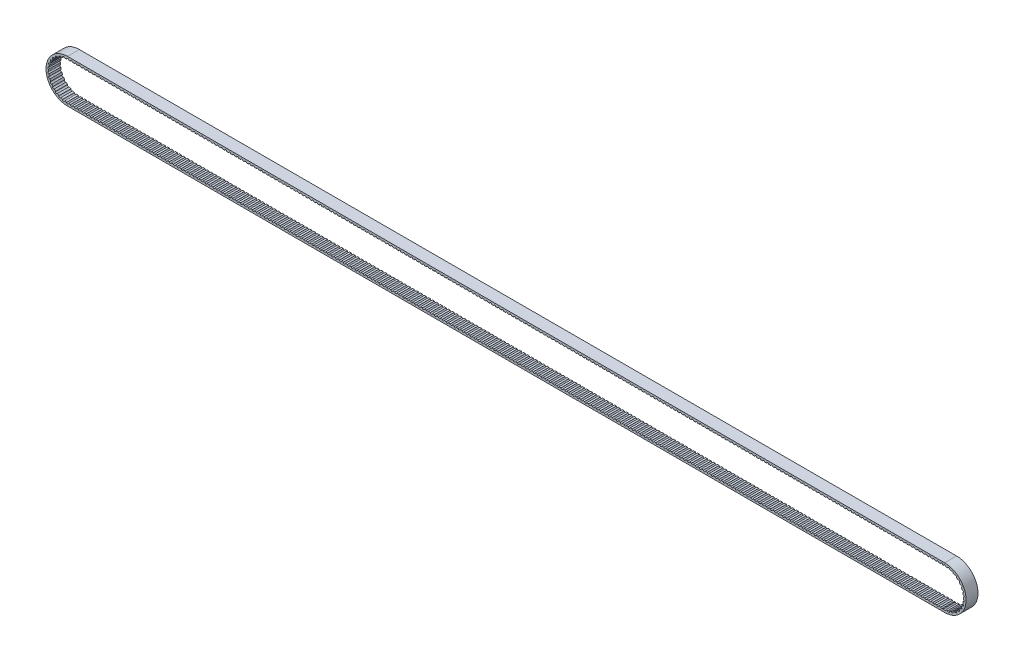
from build123d import *

# Parameters (mm, degrees)
EXTRUDE_THIN1_DEPTH      = 3
SKETCH2_R                = 0.5
CUT_EXTRUDE1_DEPTH       = 233.961566143
LPATTERN1_COUNT          = 222
LPATTERN1_PITCH          = 2
CIRPATTERN1_COUNT        = 16
CIRPATTERN1_ANGLE        = 180
MIRROR1_START            = -4
MIRROR1_DEPTH            = 8
MIRROR2_COPY_1_SKETCH_R  = 0.5
MIRROR2_COPY_1_DEPTH     = 233.961566143
MIRROR2_COPY_2_SKETCH_R  = 0.5
MIRROR2_COPY_2_DEPTH     = 233.961566143
MIRROR2_COPY_3_SKETCH_R  = 0.5
MIRROR2_COPY_3_DEPTH     = 233.961566143
MIRROR2_COPY_4_SKETCH_R  = 0.5
MIRROR2_COPY_4_DEPTH     = 233.961566143
MIRROR2_COPY_5_SKETCH_R  = 0.5
MIRROR2_COPY_5_DEPTH     = 233.961566143
MIRROR2_COPY_6_SKETCH_R  = 0.5
MIRROR2_COPY_6_DEPTH     = 233.961566143
MIRROR2_COPY_7_SKETCH_R  = 0.5
MIRROR2_COPY_7_DEPTH     = 233.961566143
MIRROR2_COPY_8_SKETCH_R  = 0.5
MIRROR2_COPY_8_DEPTH     = 233.961566143
MIRROR2_COPY_9_SKETCH_R  = 0.5
MIRROR2_COPY_9_DEPTH     = 233.961566143
MIRROR2_COPY_10_SKETCH_R = 0.5
MIRROR2_COPY_10_DEPTH    = 233.961566143
MIRROR2_COPY_11_SKETCH_R = 0.5
MIRROR2_COPY_11_DEPTH    = 233.961566143
MIRROR2_COPY_12_SKETCH_R = 0.5
MIRROR2_COPY_12_DEPTH    = 233.961566143
MIRROR2_COPY_13_SKETCH_R = 0.5
MIRROR2_COPY_13_DEPTH    = 233.961566143
MIRROR2_COPY_14_SKETCH_R = 0.5
MIRROR2_COPY_14_DEPTH    = 233.961566143
MIRROR2_COPY_15_SKETCH_R = 0.5
MIRROR2_COPY_15_DEPTH    = 233.961566143


with BuildPart() as part:
    # Sketch1 → Extrude-Thin1 (new, symmetric)
    with BuildSketch(Plane.XY):
        with BuildLine():
            Line((221.75, -10.88), (-221.75, -10.88))
            ThreePointArc((-221.75, -10.88), (-232.63, 0), (-221.75, 10.88))
            Line((-221.75, 10.88), (221.75, 10.88))
            ThreePointArc((221.75, 10.88), (232.63, 0), (221.75, -10.88))
        make_face()
        with BuildLine():
            Line((221.75, -9.5), (-221.75, -9.5))
            ThreePointArc((-221.75, -9.5), (-231.25, 0), (-221.75, 9.5))
            Line((-221.75, 9.5), (221.75, 9.5))
            ThreePointArc((221.75, 9.5), (231.25, 0), (221.75, -9.5))
        make_face(mode=Mode.SUBTRACT)
    extrude(amount=EXTRUDE_THIN1_DEPTH, both=True)

    # Sketch2 → Cut-Extrude1 (cut, through all)
    with BuildSketch(Plane.XY.offset(3)):
        with Locations((-221.75, 9.5)):
            Circle(SKETCH2_R)
    cut_extrude1 = extrude(amount=-CUT_EXTRUDE1_DEPTH, mode=Mode.SUBTRACT)

    # LPattern1: Cut-Extrude1 ×222
    with Locations(*[(i * LPATTERN1_PITCH, 0, 0) for i in range(1, LPATTERN1_COUNT)]):
        add(cut_extrude1, mode=Mode.SUBTRACT)

    # CirPattern1: Cut-Extrude1 ×16 about axis
    cirpattern1_axis = Axis((-221.75, 0, 0), (0, 0, 1))
    for i in range(1, CIRPATTERN1_COUNT):
        add(cut_extrude1.rotate(cirpattern1_axis, i * CIRPATTERN1_ANGLE / (CIRPATTERN1_COUNT - 1)), mode=Mode.SUBTRACT)

    # Mirror1: read off the stored shape, not the designer's step
    # Mirror1 outline → Mirror1 (cut)
    with BuildSketch(Plane.XY.offset(MIRROR1_START)):
        with BuildLine():
            Line((-219.25, -9.5), (-220.25, -9.5))
            ThreePointArc((-220.25, -9.5), (-219.75, -10), (-219.25, -9.5))
        make_face()
        with BuildLine():
            Line((220.75, -9.5), (219.75, -9.5))
            ThreePointArc((219.75, -9.5), (220.25, -10), (220.75, -9.5))
        make_face()
        with BuildLine():
            Line((218.75, -9.5), (217.75, -9.5))
            ThreePointArc((217.75, -9.5), (218.25, -10), (218.75, -9.5))
        make_face()
        with BuildLine():
            Line((216.75, -9.5), (215.75, -9.5))
            ThreePointArc((215.75, -9.5), (216.25, -10), (216.75, -9.5))
        make_face()
        with BuildLine():
            Line((214.75, -9.5), (213.75, -9.5))
            ThreePointArc((213.75, -9.5), (214.25, -10), (214.75, -9.5))
        make_face()
        with BuildLine():
            Line((212.75, -9.5), (211.75, -9.5))
            ThreePointArc((211.75, -9.5), (212.25, -10), (212.75, -9.5))
        make_face()
        with BuildLine():
            Line((210.75, -9.5), (209.75, -9.5))
            ThreePointArc((209.75, -9.5), (210.25, -10), (210.75, -9.5))
        make_face()
        with BuildLine():
            Line((208.75, -9.5), (207.75, -9.5))
            ThreePointArc((207.75, -9.5), (208.25, -10), (208.75, -9.5))
        make_face()
        with BuildLine():
            Line((206.75, -9.5), (205.75, -9.5))
            ThreePointArc((205.75, -9.5), (206.25, -10), (206.75, -9.5))
        make_face()
        with BuildLine():
            Line((204.75, -9.5), (203.75, -9.5))
            ThreePointArc((203.75, -9.5), (204.25, -10), (204.75, -9.5))
        make_face()
        with BuildLine():
            Line((202.75, -9.5), (201.75, -9.5))
            ThreePointArc((201.75, -9.5), (202.25, -10), (202.75, -9.5))
        make_face()
        with BuildLine():
            Line((200.75, -9.5), (199.75, -9.5))
            ThreePointArc((199.75, -9.5), (200.25, -10), (200.75, -9.5))
        make_face()
        with BuildLine():
            Line((198.75, -9.5), (197.75, -9.5))
            ThreePointArc((197.75, -9.5), (198.25, -10), (198.75, -9.5))
        make_face()
        with BuildLine():
            Line((196.75, -9.5), (195.75, -9.5))
            ThreePointArc((195.75, -9.5), (196.25, -10), (196.75, -9.5))
        make_face()
        with BuildLine():
            Line((194.75, -9.5), (193.75, -9.5))
            ThreePointArc((193.75, -9.5), (194.25, -10), (194.75, -9.5))
        make_face()
        with BuildLine():
            Line((192.75, -9.5), (191.75, -9.5))
            ThreePointArc((191.75, -9.5), (192.25, -10), (192.75, -9.5))
        make_face()
        with BuildLine():
            Line((190.75, -9.5), (189.75, -9.5))
            ThreePointArc((189.75, -9.5), (190.25, -10), (190.75, -9.5))
        make_face()
        with BuildLine():
            Line((188.75, -9.5), (187.75, -9.5))
            ThreePointArc((187.75, -9.5), (188.25, -10), (188.75, -9.5))
        make_face()
        with BuildLine():
            Line((186.75, -9.5), (185.75, -9.5))
            ThreePointArc((185.75, -9.5), (186.25, -10), (186.75, -9.5))
        make_face()
        with BuildLine():
            Line((184.75, -9.5), (183.75, -9.5))
            ThreePointArc((183.75, -9.5), (184.25, -10), (184.75, -9.5))
        make_face()
        with BuildLine():
            Line((182.75, -9.5), (181.75, -9.5))
            ThreePointArc((181.75, -9.5), (182.25, -10), (182.75, -9.5))
        make_face()
        with BuildLine():
            Line((180.75, -9.5), (179.75, -9.5))
            ThreePointArc((179.75, -9.5), (180.25, -10), (180.75, -9.5))
        make_face()
        with BuildLine():
            Line((178.75, -9.5), (177.75, -9.5))
            ThreePointArc((177.75, -9.5), (178.25, -10), (178.75, -9.5))
        make_face()
        with BuildLine():
            Line((176.75, -9.5), (175.75, -9.5))
            ThreePointArc((175.75, -9.5), (176.25, -10), (176.75, -9.5))
        make_face()
        with BuildLine():
            Line((174.75, -9.5), (173.75, -9.5))
            ThreePointArc((173.75, -9.5), (174.25, -10), (174.75, -9.5))
        make_face()
        with BuildLine():
            Line((172.75, -9.5), (171.75, -9.5))
            ThreePointArc((171.75, -9.5), (172.25, -10), (172.75, -9.5))
        make_face()
        with BuildLine():
            Line((170.75, -9.5), (169.75, -9.5))
            ThreePointArc((169.75, -9.5), (170.25, -10), (170.75, -9.5))
        make_face()
        with BuildLine():
            Line((168.75, -9.5), (167.75, -9.5))
            ThreePointArc((167.75, -9.5), (168.25, -10), (168.75, -9.5))
        make_face()
        with BuildLine():
            Line((166.75, -9.5), (165.75, -9.5))
            ThreePointArc((165.75, -9.5), (166.25, -10), (166.75, -9.5))
        make_face()
        with BuildLine():
            Line((164.75, -9.5), (163.75, -9.5))
            ThreePointArc((163.75, -9.5), (164.25, -10), (164.75, -9.5))
        make_face()
        with BuildLine():
            Line((162.75, -9.5), (161.75, -9.5))
            ThreePointArc((161.75, -9.5), (162.25, -10), (162.75, -9.5))
        make_face()
        with BuildLine():
            Line((160.75, -9.5), (159.75, -9.5))
            ThreePointArc((159.75, -9.5), (160.25, -10), (160.75, -9.5))
        make_face()
        with BuildLine():
            Line((158.75, -9.5), (157.75, -9.5))
            ThreePointArc((157.75, -9.5), (158.25, -10), (158.75, -9.5))
        make_face()
        with BuildLine():
            Line((156.75, -9.5), (155.75, -9.5))
            ThreePointArc((155.75, -9.5), (156.25, -10), (156.75, -9.5))
        make_face()
        with BuildLine():
            Line((154.75, -9.5), (153.75, -9.5))
            ThreePointArc((153.75, -9.5), (154.25, -10), (154.75, -9.5))
        make_face()
        with BuildLine():
            Line((152.75, -9.5), (151.75, -9.5))
            ThreePointArc((151.75, -9.5), (152.25, -10), (152.75, -9.5))
        make_face()
        with BuildLine():
            Line((150.75, -9.5), (149.75, -9.5))
            ThreePointArc((149.75, -9.5), (150.25, -10), (150.75, -9.5))
        make_face()
        with BuildLine():
            Line((148.75, -9.5), (147.75, -9.5))
            ThreePointArc((147.75, -9.5), (148.25, -10), (148.75, -9.5))
        make_face()
        with BuildLine():
            Line((146.75, -9.5), (145.75, -9.5))
            ThreePointArc((145.75, -9.5), (146.25, -10), (146.75, -9.5))
        make_face()
        with BuildLine():
            Line((144.75, -9.5), (143.75, -9.5))
            ThreePointArc((143.75, -9.5), (144.25, -10), (144.75, -9.5))
        make_face()
        with BuildLine():
            Line((142.75, -9.5), (141.75, -9.5))
            ThreePointArc((141.75, -9.5), (142.25, -10), (142.75, -9.5))
        make_face()
        with BuildLine():
            Line((140.75, -9.5), (139.75, -9.5))
            ThreePointArc((139.75, -9.5), (140.25, -10), (140.75, -9.5))
        make_face()
        with BuildLine():
            Line((138.75, -9.5), (137.75, -9.5))
            ThreePointArc((137.75, -9.5), (138.25, -10), (138.75, -9.5))
        make_face()
        with BuildLine():
            Line((136.75, -9.5), (135.75, -9.5))
            ThreePointArc((135.75, -9.5), (136.25, -10), (136.75, -9.5))
        make_face()
        with BuildLine():
            Line((134.75, -9.5), (133.75, -9.5))
            ThreePointArc((133.75, -9.5), (134.25, -10), (134.75, -9.5))
        make_face()
        with BuildLine():
            Line((132.75, -9.5), (131.75, -9.5))
            ThreePointArc((131.75, -9.5), (132.25, -10), (132.75, -9.5))
        make_face()
        with BuildLine():
            Line((130.75, -9.5), (129.75, -9.5))
            ThreePointArc((129.75, -9.5), (130.25, -10), (130.75, -9.5))
        make_face()
        with BuildLine():
            Line((128.75, -9.5), (127.75, -9.5))
            ThreePointArc((127.75, -9.5), (128.25, -10), (128.75, -9.5))
        make_face()
        with BuildLine():
            Line((126.75, -9.5), (125.75, -9.5))
            ThreePointArc((125.75, -9.5), (126.25, -10), (126.75, -9.5))
        make_face()
        with BuildLine():
            Line((124.75, -9.5), (123.75, -9.5))
            ThreePointArc((123.75, -9.5), (124.25, -10), (124.75, -9.5))
        make_face()
        with BuildLine():
            Line((122.75, -9.5), (121.75, -9.5))
            ThreePointArc((121.75, -9.5), (122.25, -10), (122.75, -9.5))
        make_face()
        with BuildLine():
            Line((120.75, -9.5), (119.75, -9.5))
            ThreePointArc((119.75, -9.5), (120.25, -10), (120.75, -9.5))
        make_face()
        with BuildLine():
            Line((118.75, -9.5), (117.75, -9.5))
            ThreePointArc((117.75, -9.5), (118.25, -10), (118.75, -9.5))
        make_face()
        with BuildLine():
            Line((116.75, -9.5), (115.75, -9.5))
            ThreePointArc((115.75, -9.5), (116.25, -10), (116.75, -9.5))
        make_face()
        with BuildLine():
            Line((114.75, -9.5), (113.75, -9.5))
            ThreePointArc((113.75, -9.5), (114.25, -10), (114.75, -9.5))
        make_face()
        with BuildLine():
            Line((112.75, -9.5), (111.75, -9.5))
            ThreePointArc((111.75, -9.5), (112.25, -10), (112.75, -9.5))
        make_face()
        with BuildLine():
            Line((110.75, -9.5), (109.75, -9.5))
            ThreePointArc((109.75, -9.5), (110.25, -10), (110.75, -9.5))
        make_face()
        with BuildLine():
            Line((108.75, -9.5), (107.75, -9.5))
            ThreePointArc((107.75, -9.5), (108.25, -10), (108.75, -9.5))
        make_face()
        with BuildLine():
            Line((106.75, -9.5), (105.75, -9.5))
            ThreePointArc((105.75, -9.5), (106.25, -10), (106.75, -9.5))
        make_face()
        with BuildLine():
            Line((104.75, -9.5), (103.75, -9.5))
            ThreePointArc((103.75, -9.5), (104.25, -10), (104.75, -9.5))
        make_face()
        with BuildLine():
            Line((102.75, -9.5), (101.75, -9.5))
            ThreePointArc((101.75, -9.5), (102.25, -10), (102.75, -9.5))
        make_face()
        with BuildLine():
            Line((100.75, -9.5), (99.75, -9.5))
            ThreePointArc((99.75, -9.5), (100.25, -10), (100.75, -9.5))
        make_face()
        with BuildLine():
            Line((98.75, -9.5), (97.75, -9.5))
            ThreePointArc((97.75, -9.5), (98.25, -10), (98.75, -9.5))
        make_face()
        with BuildLine():
            Line((96.75, -9.5), (95.75, -9.5))
            ThreePointArc((95.75, -9.5), (96.25, -10), (96.75, -9.5))
        make_face()
        with BuildLine():
            Line((94.75, -9.5), (93.75, -9.5))
            ThreePointArc((93.75, -9.5), (94.25, -10), (94.75, -9.5))
        make_face()
        with BuildLine():
            Line((92.75, -9.5), (91.75, -9.5))
            ThreePointArc((91.75, -9.5), (92.25, -10), (92.75, -9.5))
        make_face()
        with BuildLine():
            Line((90.75, -9.5), (89.75, -9.5))
            ThreePointArc((89.75, -9.5), (90.25, -10), (90.75, -9.5))
        make_face()
        with BuildLine():
            Line((88.75, -9.5), (87.75, -9.5))
            ThreePointArc((87.75, -9.5), (88.25, -10), (88.75, -9.5))
        make_face()
        with BuildLine():
            Line((86.75, -9.5), (85.75, -9.5))
            ThreePointArc((85.75, -9.5), (86.25, -10), (86.75, -9.5))
        make_face()
        with BuildLine():
            Line((84.75, -9.5), (83.75, -9.5))
            ThreePointArc((83.75, -9.5), (84.25, -10), (84.75, -9.5))
        make_face()
        with BuildLine():
            Line((82.75, -9.5), (81.75, -9.5))
            ThreePointArc((81.75, -9.5), (82.25, -10), (82.75, -9.5))
        make_face()
        with BuildLine():
            Line((80.75, -9.5), (79.75, -9.5))
            ThreePointArc((79.75, -9.5), (80.25, -10), (80.75, -9.5))
        make_face()
        with BuildLine():
            Line((78.75, -9.5), (77.75, -9.5))
            ThreePointArc((77.75, -9.5), (78.25, -10), (78.75, -9.5))
        make_face()
        with BuildLine():
            Line((76.75, -9.5), (75.75, -9.5))
            ThreePointArc((75.75, -9.5), (76.25, -10), (76.75, -9.5))
        make_face()
        with BuildLine():
            Line((74.75, -9.5), (73.75, -9.5))
            ThreePointArc((73.75, -9.5), (74.25, -10), (74.75, -9.5))
        make_face()
        with BuildLine():
            Line((72.75, -9.5), (71.75, -9.5))
            ThreePointArc((71.75, -9.5), (72.25, -10), (72.75, -9.5))
        make_face()
        with BuildLine():
            Line((70.75, -9.5), (69.75, -9.5))
            ThreePointArc((69.75, -9.5), (70.25, -10), (70.75, -9.5))
        make_face()
        with BuildLine():
            Line((68.75, -9.5), (67.75, -9.5))
            ThreePointArc((67.75, -9.5), (68.25, -10), (68.75, -9.5))
        make_face()
        with BuildLine():
            Line((66.75, -9.5), (65.75, -9.5))
            ThreePointArc((65.75, -9.5), (66.25, -10), (66.75, -9.5))
        make_face()
        with BuildLine():
            Line((64.75, -9.5), (63.75, -9.5))
            ThreePointArc((63.75, -9.5), (64.25, -10), (64.75, -9.5))
        make_face()
        with BuildLine():
            Line((62.75, -9.5), (61.75, -9.5))
            ThreePointArc((61.75, -9.5), (62.25, -10), (62.75, -9.5))
        make_face()
        with BuildLine():
            Line((60.75, -9.5), (59.75, -9.5))
            ThreePointArc((59.75, -9.5), (60.25, -10), (60.75, -9.5))
        make_face()
        with BuildLine():
            Line((58.75, -9.5), (57.75, -9.5))
            ThreePointArc((57.75, -9.5), (58.25, -10), (58.75, -9.5))
        make_face()
        with BuildLine():
            Line((56.75, -9.5), (55.75, -9.5))
            ThreePointArc((55.75, -9.5), (56.25, -10), (56.75, -9.5))
        make_face()
        with BuildLine():
            Line((54.75, -9.5), (53.75, -9.5))
            ThreePointArc((53.75, -9.5), (54.25, -10), (54.75, -9.5))
        make_face()
        with BuildLine():
            Line((52.75, -9.5), (51.75, -9.5))
            ThreePointArc((51.75, -9.5), (52.25, -10), (52.75, -9.5))
        make_face()
        with BuildLine():
            Line((50.75, -9.5), (49.75, -9.5))
            ThreePointArc((49.75, -9.5), (50.25, -10), (50.75, -9.5))
        make_face()
        with BuildLine():
            Line((48.75, -9.5), (47.75, -9.5))
            ThreePointArc((47.75, -9.5), (48.25, -10), (48.75, -9.5))
        make_face()
        with BuildLine():
            Line((46.75, -9.5), (45.75, -9.5))
            ThreePointArc((45.75, -9.5), (46.25, -10), (46.75, -9.5))
        make_face()
        with BuildLine():
            Line((44.75, -9.5), (43.75, -9.5))
            ThreePointArc((43.75, -9.5), (44.25, -10), (44.75, -9.5))
        make_face()
        with BuildLine():
            Line((42.75, -9.5), (41.75, -9.5))
            ThreePointArc((41.75, -9.5), (42.25, -10), (42.75, -9.5))
        make_face()
        with BuildLine():
            Line((40.75, -9.5), (39.75, -9.5))
            ThreePointArc((39.75, -9.5), (40.25, -10), (40.75, -9.5))
        make_face()
        with BuildLine():
            Line((38.75, -9.5), (37.75, -9.5))
            ThreePointArc((37.75, -9.5), (38.25, -10), (38.75, -9.5))
        make_face()
        with BuildLine():
            Line((36.75, -9.5), (35.75, -9.5))
            ThreePointArc((35.75, -9.5), (36.25, -10), (36.75, -9.5))
        make_face()
        with BuildLine():
            Line((34.75, -9.5), (33.75, -9.5))
            ThreePointArc((33.75, -9.5), (34.25, -10), (34.75, -9.5))
        make_face()
        with BuildLine():
            Line((32.75, -9.5), (31.75, -9.5))
            ThreePointArc((31.75, -9.5), (32.25, -10), (32.75, -9.5))
        make_face()
        with BuildLine():
            Line((30.75, -9.5), (29.75, -9.5))
            ThreePointArc((29.75, -9.5), (30.25, -10), (30.75, -9.5))
        make_face()
        with BuildLine():
            Line((28.75, -9.5), (27.75, -9.5))
            ThreePointArc((27.75, -9.5), (28.25, -10), (28.75, -9.5))
        make_face()
        with BuildLine():
            Line((26.75, -9.5), (25.75, -9.5))
            ThreePointArc((25.75, -9.5), (26.25, -10), (26.75, -9.5))
        make_face()
        with BuildLine():
            Line((24.75, -9.5), (23.75, -9.5))
            ThreePointArc((23.75, -9.5), (24.25, -10), (24.75, -9.5))
        make_face()
        with BuildLine():
            Line((22.75, -9.5), (21.75, -9.5))
            ThreePointArc((21.75, -9.5), (22.25, -10), (22.75, -9.5))
        make_face()
        with BuildLine():
            Line((20.75, -9.5), (19.75, -9.5))
            ThreePointArc((19.75, -9.5), (20.25, -10), (20.75, -9.5))
        make_face()
        with BuildLine():
            Line((18.75, -9.5), (17.75, -9.5))
            ThreePointArc((17.75, -9.5), (18.25, -10), (18.75, -9.5))
        make_face()
        with BuildLine():
            Line((16.75, -9.5), (15.75, -9.5))
            ThreePointArc((15.75, -9.5), (16.25, -10), (16.75, -9.5))
        make_face()
        with BuildLine():
            Line((14.75, -9.5), (13.75, -9.5))
            ThreePointArc((13.75, -9.5), (14.25, -10), (14.75, -9.5))
        make_face()
        with BuildLine():
            Line((12.75, -9.5), (11.75, -9.5))
            ThreePointArc((11.75, -9.5), (12.25, -10), (12.75, -9.5))
        make_face()
        with BuildLine():
            Line((10.75, -9.5), (9.75, -9.5))
            ThreePointArc((9.75, -9.5), (10.25, -10), (10.75, -9.5))
        make_face()
        with BuildLine():
            Line((8.75, -9.5), (7.75, -9.5))
            ThreePointArc((7.75, -9.5), (8.25, -10), (8.75, -9.5))
        make_face()
        with BuildLine():
            Line((6.75, -9.5), (5.75, -9.5))
            ThreePointArc((5.75, -9.5), (6.25, -10), (6.75, -9.5))
        make_face()
        with BuildLine():
            Line((4.75, -9.5), (3.75, -9.5))
            ThreePointArc((3.75, -9.5), (4.25, -10), (4.75, -9.5))
        make_face()
        with BuildLine():
            Line((2.75, -9.5), (1.75, -9.5))
            ThreePointArc((1.75, -9.5), (2.25, -10), (2.75, -9.5))
        make_face()
        with BuildLine():
            Line((0.75, -9.5), (-0.25, -9.5))
            ThreePointArc((-0.25, -9.5), (0.25, -10), (0.75, -9.5))
        make_face()
        with BuildLine():
            Line((-1.25, -9.5), (-2.25, -9.5))
            ThreePointArc((-2.25, -9.5), (-1.75, -10), (-1.25, -9.5))
        make_face()
        with BuildLine():
            Line((-3.25, -9.5), (-4.25, -9.5))
            ThreePointArc((-4.25, -9.5), (-3.75, -10), (-3.25, -9.5))
        make_face()
        with BuildLine():
            Line((-5.25, -9.5), (-6.25, -9.5))
            ThreePointArc((-6.25, -9.5), (-5.75, -10), (-5.25, -9.5))
        make_face()
        with BuildLine():
            Line((-7.25, -9.5), (-8.25, -9.5))
            ThreePointArc((-8.25, -9.5), (-7.75, -10), (-7.25, -9.5))
        make_face()
        with BuildLine():
            Line((-9.25, -9.5), (-10.25, -9.5))
            ThreePointArc((-10.25, -9.5), (-9.75, -10), (-9.25, -9.5))
        make_face()
        with BuildLine():
            Line((-11.25, -9.5), (-12.25, -9.5))
            ThreePointArc((-12.25, -9.5), (-11.75, -10), (-11.25, -9.5))
        make_face()
        with BuildLine():
            Line((-13.25, -9.5), (-14.25, -9.5))
            ThreePointArc((-14.25, -9.5), (-13.75, -10), (-13.25, -9.5))
        make_face()
        with BuildLine():
            Line((-15.25, -9.5), (-16.25, -9.5))
            ThreePointArc((-16.25, -9.5), (-15.75, -10), (-15.25, -9.5))
        make_face()
        with BuildLine():
            Line((-17.25, -9.5), (-18.25, -9.5))
            ThreePointArc((-18.25, -9.5), (-17.75, -10), (-17.25, -9.5))
        make_face()
        with BuildLine():
            Line((-19.25, -9.5), (-20.25, -9.5))
            ThreePointArc((-20.25, -9.5), (-19.75, -10), (-19.25, -9.5))
        make_face()
        with BuildLine():
            Line((-21.25, -9.5), (-22.25, -9.5))
            ThreePointArc((-22.25, -9.5), (-21.75, -10), (-21.25, -9.5))
        make_face()
        with BuildLine():
            Line((-23.25, -9.5), (-24.25, -9.5))
            ThreePointArc((-24.25, -9.5), (-23.75, -10), (-23.25, -9.5))
        make_face()
        with BuildLine():
            Line((-25.25, -9.5), (-26.25, -9.5))
            ThreePointArc((-26.25, -9.5), (-25.75, -10), (-25.25, -9.5))
        make_face()
        with BuildLine():
            Line((-27.25, -9.5), (-28.25, -9.5))
            ThreePointArc((-28.25, -9.5), (-27.75, -10), (-27.25, -9.5))
        make_face()
        with BuildLine():
            Line((-29.25, -9.5), (-30.25, -9.5))
            ThreePointArc((-30.25, -9.5), (-29.75, -10), (-29.25, -9.5))
        make_face()
        with BuildLine():
            Line((-31.25, -9.5), (-32.25, -9.5))
            ThreePointArc((-32.25, -9.5), (-31.75, -10), (-31.25, -9.5))
        make_face()
        with BuildLine():
            Line((-33.25, -9.5), (-34.25, -9.5))
            ThreePointArc((-34.25, -9.5), (-33.75, -10), (-33.25, -9.5))
        make_face()
        with BuildLine():
            Line((-35.25, -9.5), (-36.25, -9.5))
            ThreePointArc((-36.25, -9.5), (-35.75, -10), (-35.25, -9.5))
        make_face()
        with BuildLine():
            Line((-37.25, -9.5), (-38.25, -9.5))
            ThreePointArc((-38.25, -9.5), (-37.75, -10), (-37.25, -9.5))
        make_face()
        with BuildLine():
            Line((-39.25, -9.5), (-40.25, -9.5))
            ThreePointArc((-40.25, -9.5), (-39.75, -10), (-39.25, -9.5))
        make_face()
        with BuildLine():
            Line((-41.25, -9.5), (-42.25, -9.5))
            ThreePointArc((-42.25, -9.5), (-41.75, -10), (-41.25, -9.5))
        make_face()
        with BuildLine():
            Line((-43.25, -9.5), (-44.25, -9.5))
            ThreePointArc((-44.25, -9.5), (-43.75, -10), (-43.25, -9.5))
        make_face()
        with BuildLine():
            Line((-45.25, -9.5), (-46.25, -9.5))
            ThreePointArc((-46.25, -9.5), (-45.75, -10), (-45.25, -9.5))
        make_face()
        with BuildLine():
            Line((-47.25, -9.5), (-48.25, -9.5))
            ThreePointArc((-48.25, -9.5), (-47.75, -10), (-47.25, -9.5))
        make_face()
        with BuildLine():
            Line((-49.25, -9.5), (-50.25, -9.5))
            ThreePointArc((-50.25, -9.5), (-49.75, -10), (-49.25, -9.5))
        make_face()
        with BuildLine():
            Line((-51.25, -9.5), (-52.25, -9.5))
            ThreePointArc((-52.25, -9.5), (-51.75, -10), (-51.25, -9.5))
        make_face()
        with BuildLine():
            Line((-53.25, -9.5), (-54.25, -9.5))
            ThreePointArc((-54.25, -9.5), (-53.75, -10), (-53.25, -9.5))
        make_face()
        with BuildLine():
            Line((-55.25, -9.5), (-56.25, -9.5))
            ThreePointArc((-56.25, -9.5), (-55.75, -10), (-55.25, -9.5))
        make_face()
        with BuildLine():
            Line((-57.25, -9.5), (-58.25, -9.5))
            ThreePointArc((-58.25, -9.5), (-57.75, -10), (-57.25, -9.5))
        make_face()
        with BuildLine():
            Line((-59.25, -9.5), (-60.25, -9.5))
            ThreePointArc((-60.25, -9.5), (-59.75, -10), (-59.25, -9.5))
        make_face()
        with BuildLine():
            Line((-61.25, -9.5), (-62.25, -9.5))
            ThreePointArc((-62.25, -9.5), (-61.75, -10), (-61.25, -9.5))
        make_face()
        with BuildLine():
            Line((-63.25, -9.5), (-64.25, -9.5))
            ThreePointArc((-64.25, -9.5), (-63.75, -10), (-63.25, -9.5))
        make_face()
        with BuildLine():
            Line((-65.25, -9.5), (-66.25, -9.5))
            ThreePointArc((-66.25, -9.5), (-65.75, -10), (-65.25, -9.5))
        make_face()
        with BuildLine():
            Line((-67.25, -9.5), (-68.25, -9.5))
            ThreePointArc((-68.25, -9.5), (-67.75, -10), (-67.25, -9.5))
        make_face()
        with BuildLine():
            Line((-69.25, -9.5), (-70.25, -9.5))
            ThreePointArc((-70.25, -9.5), (-69.75, -10), (-69.25, -9.5))
        make_face()
        with BuildLine():
            Line((-71.25, -9.5), (-72.25, -9.5))
            ThreePointArc((-72.25, -9.5), (-71.75, -10), (-71.25, -9.5))
        make_face()
        with BuildLine():
            Line((-73.25, -9.5), (-74.25, -9.5))
            ThreePointArc((-74.25, -9.5), (-73.75, -10), (-73.25, -9.5))
        make_face()
        with BuildLine():
            Line((-75.25, -9.5), (-76.25, -9.5))
            ThreePointArc((-76.25, -9.5), (-75.75, -10), (-75.25, -9.5))
        make_face()
        with BuildLine():
            Line((-77.25, -9.5), (-78.25, -9.5))
            ThreePointArc((-78.25, -9.5), (-77.75, -10), (-77.25, -9.5))
        make_face()
        with BuildLine():
            Line((-79.25, -9.5), (-80.25, -9.5))
            ThreePointArc((-80.25, -9.5), (-79.75, -10), (-79.25, -9.5))
        make_face()
        with BuildLine():
            Line((-81.25, -9.5), (-82.25, -9.5))
            ThreePointArc((-82.25, -9.5), (-81.75, -10), (-81.25, -9.5))
        make_face()
        with BuildLine():
            Line((-83.25, -9.5), (-84.25, -9.5))
            ThreePointArc((-84.25, -9.5), (-83.75, -10), (-83.25, -9.5))
        make_face()
        with BuildLine():
            Line((-85.25, -9.5), (-86.25, -9.5))
            ThreePointArc((-86.25, -9.5), (-85.75, -10), (-85.25, -9.5))
        make_face()
        with BuildLine():
            Line((-87.25, -9.5), (-88.25, -9.5))
            ThreePointArc((-88.25, -9.5), (-87.75, -10), (-87.25, -9.5))
        make_face()
        with BuildLine():
            Line((-89.25, -9.5), (-90.25, -9.5))
            ThreePointArc((-90.25, -9.5), (-89.75, -10), (-89.25, -9.5))
        make_face()
        with BuildLine():
            Line((-91.25, -9.5), (-92.25, -9.5))
            ThreePointArc((-92.25, -9.5), (-91.75, -10), (-91.25, -9.5))
        make_face()
        with BuildLine():
            Line((-93.25, -9.5), (-94.25, -9.5))
            ThreePointArc((-94.25, -9.5), (-93.75, -10), (-93.25, -9.5))
        make_face()
        with BuildLine():
            Line((-95.25, -9.5), (-96.25, -9.5))
            ThreePointArc((-96.25, -9.5), (-95.75, -10), (-95.25, -9.5))
        make_face()
        with BuildLine():
            Line((-97.25, -9.5), (-98.25, -9.5))
            ThreePointArc((-98.25, -9.5), (-97.75, -10), (-97.25, -9.5))
        make_face()
        with BuildLine():
            Line((-99.25, -9.5), (-100.25, -9.5))
            ThreePointArc((-100.25, -9.5), (-99.75, -10), (-99.25, -9.5))
        make_face()
        with BuildLine():
            Line((-101.25, -9.5), (-102.25, -9.5))
            ThreePointArc((-102.25, -9.5), (-101.75, -10), (-101.25, -9.5))
        make_face()
        with BuildLine():
            Line((-103.25, -9.5), (-104.25, -9.5))
            ThreePointArc((-104.25, -9.5), (-103.75, -10), (-103.25, -9.5))
        make_face()
        with BuildLine():
            Line((-105.25, -9.5), (-106.25, -9.5))
            ThreePointArc((-106.25, -9.5), (-105.75, -10), (-105.25, -9.5))
        make_face()
        with BuildLine():
            Line((-107.25, -9.5), (-108.25, -9.5))
            ThreePointArc((-108.25, -9.5), (-107.75, -10), (-107.25, -9.5))
        make_face()
        with BuildLine():
            Line((-109.25, -9.5), (-110.25, -9.5))
            ThreePointArc((-110.25, -9.5), (-109.75, -10), (-109.25, -9.5))
        make_face()
        with BuildLine():
            Line((-111.25, -9.5), (-112.25, -9.5))
            ThreePointArc((-112.25, -9.5), (-111.75, -10), (-111.25, -9.5))
        make_face()
        with BuildLine():
            Line((-113.25, -9.5), (-114.25, -9.5))
            ThreePointArc((-114.25, -9.5), (-113.75, -10), (-113.25, -9.5))
        make_face()
        with BuildLine():
            Line((-115.25, -9.5), (-116.25, -9.5))
            ThreePointArc((-116.25, -9.5), (-115.75, -10), (-115.25, -9.5))
        make_face()
        with BuildLine():
            Line((-117.25, -9.5), (-118.25, -9.5))
            ThreePointArc((-118.25, -9.5), (-117.75, -10), (-117.25, -9.5))
        make_face()
        with BuildLine():
            Line((-119.25, -9.5), (-120.25, -9.5))
            ThreePointArc((-120.25, -9.5), (-119.75, -10), (-119.25, -9.5))
        make_face()
        with BuildLine():
            Line((-121.25, -9.5), (-122.25, -9.5))
            ThreePointArc((-122.25, -9.5), (-121.75, -10), (-121.25, -9.5))
        make_face()
        with BuildLine():
            Line((-123.25, -9.5), (-124.25, -9.5))
            ThreePointArc((-124.25, -9.5), (-123.75, -10), (-123.25, -9.5))
        make_face()
        with BuildLine():
            Line((-125.25, -9.5), (-126.25, -9.5))
            ThreePointArc((-126.25, -9.5), (-125.75, -10), (-125.25, -9.5))
        make_face()
        with BuildLine():
            Line((-127.25, -9.5), (-128.25, -9.5))
            ThreePointArc((-128.25, -9.5), (-127.75, -10), (-127.25, -9.5))
        make_face()
        with BuildLine():
            Line((-129.25, -9.5), (-130.25, -9.5))
            ThreePointArc((-130.25, -9.5), (-129.75, -10), (-129.25, -9.5))
        make_face()
        with BuildLine():
            Line((-131.25, -9.5), (-132.25, -9.5))
            ThreePointArc((-132.25, -9.5), (-131.75, -10), (-131.25, -9.5))
        make_face()
        with BuildLine():
            Line((-133.25, -9.5), (-134.25, -9.5))
            ThreePointArc((-134.25, -9.5), (-133.75, -10), (-133.25, -9.5))
        make_face()
        with BuildLine():
            Line((-135.25, -9.5), (-136.25, -9.5))
            ThreePointArc((-136.25, -9.5), (-135.75, -10), (-135.25, -9.5))
        make_face()
        with BuildLine():
            Line((-137.25, -9.5), (-138.25, -9.5))
            ThreePointArc((-138.25, -9.5), (-137.75, -10), (-137.25, -9.5))
        make_face()
        with BuildLine():
            Line((-139.25, -9.5), (-140.25, -9.5))
            ThreePointArc((-140.25, -9.5), (-139.75, -10), (-139.25, -9.5))
        make_face()
        with BuildLine():
            Line((-141.25, -9.5), (-142.25, -9.5))
            ThreePointArc((-142.25, -9.5), (-141.75, -10), (-141.25, -9.5))
        make_face()
        with BuildLine():
            Line((-143.25, -9.5), (-144.25, -9.5))
            ThreePointArc((-144.25, -9.5), (-143.75, -10), (-143.25, -9.5))
        make_face()
        with BuildLine():
            Line((-145.25, -9.5), (-146.25, -9.5))
            ThreePointArc((-146.25, -9.5), (-145.75, -10), (-145.25, -9.5))
        make_face()
        with BuildLine():
            Line((-147.25, -9.5), (-148.25, -9.5))
            ThreePointArc((-148.25, -9.5), (-147.75, -10), (-147.25, -9.5))
        make_face()
        with BuildLine():
            Line((-149.25, -9.5), (-150.25, -9.5))
            ThreePointArc((-150.25, -9.5), (-149.75, -10), (-149.25, -9.5))
        make_face()
        with BuildLine():
            Line((-151.25, -9.5), (-152.25, -9.5))
            ThreePointArc((-152.25, -9.5), (-151.75, -10), (-151.25, -9.5))
        make_face()
        with BuildLine():
            Line((-153.25, -9.5), (-154.25, -9.5))
            ThreePointArc((-154.25, -9.5), (-153.75, -10), (-153.25, -9.5))
        make_face()
        with BuildLine():
            Line((-155.25, -9.5), (-156.25, -9.5))
            ThreePointArc((-156.25, -9.5), (-155.75, -10), (-155.25, -9.5))
        make_face()
        with BuildLine():
            Line((-157.25, -9.5), (-158.25, -9.5))
            ThreePointArc((-158.25, -9.5), (-157.75, -10), (-157.25, -9.5))
        make_face()
        with BuildLine():
            Line((-159.25, -9.5), (-160.25, -9.5))
            ThreePointArc((-160.25, -9.5), (-159.75, -10), (-159.25, -9.5))
        make_face()
        with BuildLine():
            Line((-161.25, -9.5), (-162.25, -9.5))
            ThreePointArc((-162.25, -9.5), (-161.75, -10), (-161.25, -9.5))
        make_face()
        with BuildLine():
            Line((-163.25, -9.5), (-164.25, -9.5))
            ThreePointArc((-164.25, -9.5), (-163.75, -10), (-163.25, -9.5))
        make_face()
        with BuildLine():
            Line((-165.25, -9.5), (-166.25, -9.5))
            ThreePointArc((-166.25, -9.5), (-165.75, -10), (-165.25, -9.5))
        make_face()
        with BuildLine():
            Line((-167.25, -9.5), (-168.25, -9.5))
            ThreePointArc((-168.25, -9.5), (-167.75, -10), (-167.25, -9.5))
        make_face()
        with BuildLine():
            Line((-169.25, -9.5), (-170.25, -9.5))
            ThreePointArc((-170.25, -9.5), (-169.75, -10), (-169.25, -9.5))
        make_face()
        with BuildLine():
            Line((-171.25, -9.5), (-172.25, -9.5))
            ThreePointArc((-172.25, -9.5), (-171.75, -10), (-171.25, -9.5))
        make_face()
        with BuildLine():
            Line((-173.25, -9.5), (-174.25, -9.5))
            ThreePointArc((-174.25, -9.5), (-173.75, -10), (-173.25, -9.5))
        make_face()
        with BuildLine():
            Line((-175.25, -9.5), (-176.25, -9.5))
            ThreePointArc((-176.25, -9.5), (-175.75, -10), (-175.25, -9.5))
        make_face()
        with BuildLine():
            Line((-177.25, -9.5), (-178.25, -9.5))
            ThreePointArc((-178.25, -9.5), (-177.75, -10), (-177.25, -9.5))
        make_face()
        with BuildLine():
            Line((-179.25, -9.5), (-180.25, -9.5))
            ThreePointArc((-180.25, -9.5), (-179.75, -10), (-179.25, -9.5))
        make_face()
        with BuildLine():
            Line((-181.25, -9.5), (-182.25, -9.5))
            ThreePointArc((-182.25, -9.5), (-181.75, -10), (-181.25, -9.5))
        make_face()
        with BuildLine():
            Line((-183.25, -9.5), (-184.25, -9.5))
            ThreePointArc((-184.25, -9.5), (-183.75, -10), (-183.25, -9.5))
        make_face()
        with BuildLine():
            Line((-185.25, -9.5), (-186.25, -9.5))
            ThreePointArc((-186.25, -9.5), (-185.75, -10), (-185.25, -9.5))
        make_face()
        with BuildLine():
            Line((-187.25, -9.5), (-188.25, -9.5))
            ThreePointArc((-188.25, -9.5), (-187.75, -10), (-187.25, -9.5))
        make_face()
        with BuildLine():
            Line((-189.25, -9.5), (-190.25, -9.5))
            ThreePointArc((-190.25, -9.5), (-189.75, -10), (-189.25, -9.5))
        make_face()
        with BuildLine():
            Line((-191.25, -9.5), (-192.25, -9.5))
            ThreePointArc((-192.25, -9.5), (-191.75, -10), (-191.25, -9.5))
        make_face()
        with BuildLine():
            Line((-193.25, -9.5), (-194.25, -9.5))
            ThreePointArc((-194.25, -9.5), (-193.75, -10), (-193.25, -9.5))
        make_face()
        with BuildLine():
            Line((-195.25, -9.5), (-196.25, -9.5))
            ThreePointArc((-196.25, -9.5), (-195.75, -10), (-195.25, -9.5))
        make_face()
        with BuildLine():
            Line((-197.25, -9.5), (-198.25, -9.5))
            ThreePointArc((-198.25, -9.5), (-197.75, -10), (-197.25, -9.5))
        make_face()
        with BuildLine():
            Line((-199.25, -9.5), (-200.25, -9.5))
            ThreePointArc((-200.25, -9.5), (-199.75, -10), (-199.25, -9.5))
        make_face()
        with BuildLine():
            Line((-201.25, -9.5), (-202.25, -9.5))
            ThreePointArc((-202.25, -9.5), (-201.75, -10), (-201.25, -9.5))
        make_face()
        with BuildLine():
            Line((-203.25, -9.5), (-204.25, -9.5))
            ThreePointArc((-204.25, -9.5), (-203.75, -10), (-203.25, -9.5))
        make_face()
        with BuildLine():
            Line((-205.25, -9.5), (-206.25, -9.5))
            ThreePointArc((-206.25, -9.5), (-205.75, -10), (-205.25, -9.5))
        make_face()
        with BuildLine():
            Line((-207.25, -9.5), (-208.25, -9.5))
            ThreePointArc((-208.25, -9.5), (-207.75, -10), (-207.25, -9.5))
        make_face()
        with BuildLine():
            Line((-209.25, -9.5), (-210.25, -9.5))
            ThreePointArc((-210.25, -9.5), (-209.75, -10), (-209.25, -9.5))
        make_face()
        with BuildLine():
            Line((-211.25, -9.5), (-212.25, -9.5))
            ThreePointArc((-212.25, -9.5), (-211.75, -10), (-211.25, -9.5))
        make_face()
        with BuildLine():
            Line((-213.25, -9.5), (-214.25, -9.5))
            ThreePointArc((-214.25, -9.5), (-213.75, -10), (-213.25, -9.5))
        make_face()
        with BuildLine():
            Line((-215.25, -9.5), (-216.25, -9.5))
            ThreePointArc((-216.25, -9.5), (-215.75, -10), (-215.25, -9.5))
        make_face()
        with BuildLine():
            Line((-217.25, -9.5), (-218.25, -9.5))
            ThreePointArc((-218.25, -9.5), (-217.75, -10), (-217.25, -9.5))
        make_face()
    extrude(amount=MIRROR1_DEPTH, mode=Mode.SUBTRACT)

    # Mirror2: Cut-Extrude1 across plane
    add(cut_extrude1.mirror(Plane(origin=(0, 0, 0), x_dir=(0, 0, 1), z_dir=(1, 0, 0))), mode=Mode.SUBTRACT)

    # Mirror2 copy 1 sketch → Mirror2 copy 1 (cut, through all)
    with BuildSketch(Plane(origin=(4.845769537, 46.104417439, 3), x_dir=(-0.9781476007338056, 0.2079116908177598, 0), z_dir=(0, 0, 1))):
        with Locations((-221.75, -9.5)):
            Circle(MIRROR2_COPY_1_SKETCH_R)
    extrude(amount=-MIRROR2_COPY_1_DEPTH, mode=Mode.SUBTRACT)

    # Mirror2 copy 2 sketch → Mirror2 copy 2 (cut, through all)
    with BuildSketch(Plane(origin=(19.171294768, 90.193850602, 3), x_dir=(-0.9135454576426005, 0.40673664307580104, 0), z_dir=(0, 0, 1))):
        with Locations((-221.75, -9.5)):
            Circle(MIRROR2_COPY_2_SKETCH_R)
    extrude(amount=-MIRROR2_COPY_2_DEPTH, mode=Mode.SUBTRACT)

    # Mirror2 copy 3 sketch → Mirror2 copy 3 (cut, through all)
    with BuildSketch(Plane(origin=(42.350481497, 130.341379696, 3), x_dir=(-0.8090169943749467, 0.5877852522924741, 0), z_dir=(0, 0, 1))):
        with Locations((-221.75, -9.5)):
            Circle(MIRROR2_COPY_3_SKETCH_R)
    extrude(amount=-MIRROR2_COPY_3_DEPTH, mode=Mode.SUBTRACT)

    # Mirror2 copy 4 sketch → Mirror2 copy 4 (cut, through all)
    with BuildSketch(Plane(origin=(73.37028804, 164.79236505, 3), x_dir=(-0.6691306063588569, 0.7431448254773955, 0), z_dir=(0, 0, 1))):
        with Locations((-221.75, -9.5)):
            Circle(MIRROR2_COPY_4_SKETCH_R)
    extrude(amount=-MIRROR2_COPY_4_DEPTH, mode=Mode.SUBTRACT)

    # Mirror2 copy 5 sketch → Mirror2 copy 5 (cut, through all)
    with BuildSketch(Plane(origin=(110.875, 192.041133289, 3), x_dir=(-0.499999999999998, 0.8660254037844398, 0), z_dir=(0, 0, 1))):
        with Locations((-221.75, -9.5)):
            Circle(MIRROR2_COPY_5_SKETCH_R)
    extrude(amount=-MIRROR2_COPY_5_DEPTH, mode=Mode.SUBTRACT)

    # Mirror2 copy 6 sketch → Mirror2 copy 6 (cut, through all)
    with BuildSketch(Plane(origin=(153.225481497, 210.896782488, 3), x_dir=(-0.30901699437494495, 0.9510565162951544, 0), z_dir=(0, 0, 1))):
        with Locations((-221.75, -9.5)):
            Circle(MIRROR2_COPY_6_SKETCH_R)
    extrude(amount=-MIRROR2_COPY_6_DEPTH, mode=Mode.SUBTRACT)

    # Mirror2 copy 7 sketch → Mirror2 copy 7 (cut, through all)
    with BuildSketch(Plane(origin=(198.57081327, 220.535230298, 3), x_dir=(-0.10452846326765036, 0.9945218953682736, 0), z_dir=(0, 0, 1))):
        with Locations((-221.75, -9.5)):
            Circle(MIRROR2_COPY_7_SKETCH_R)
    extrude(amount=-MIRROR2_COPY_7_DEPTH, mode=Mode.SUBTRACT)

    # Mirror2 copy 8 sketch → Mirror2 copy 8 (cut, through all)
    with BuildSketch(Plane(origin=(244.92918673, 220.535230298, 3), x_dir=(0.10452846326765709, 0.994521895368273, 0), z_dir=(0, 0, 1))):
        with Locations((-221.75, -9.5)):
            Circle(MIRROR2_COPY_8_SKETCH_R)
    extrude(amount=-MIRROR2_COPY_8_DEPTH, mode=Mode.SUBTRACT)

    # Mirror2 copy 9 sketch → Mirror2 copy 9 (cut, through all)
    with BuildSketch(Plane(origin=(290.274518503, 210.896782488, 3), x_dir=(0.3090169943749514, 0.9510565162951523, 0), z_dir=(0, 0, 1))):
        with Locations((-221.75, -9.5)):
            Circle(MIRROR2_COPY_9_SKETCH_R)
    extrude(amount=-MIRROR2_COPY_9_DEPTH, mode=Mode.SUBTRACT)

    # Mirror2 copy 10 sketch → Mirror2 copy 10 (cut, through all)
    with BuildSketch(Plane(origin=(332.625, 192.041133289, 3), x_dir=(0.500000000000004, 0.8660254037844363, 0), z_dir=(0, 0, 1))):
        with Locations((-221.75, -9.5)):
            Circle(MIRROR2_COPY_10_SKETCH_R)
    extrude(amount=-MIRROR2_COPY_10_DEPTH, mode=Mode.SUBTRACT)

    # Mirror2 copy 11 sketch → Mirror2 copy 11 (cut, through all)
    with BuildSketch(Plane(origin=(370.12971196, 164.79236505, 3), x_dir=(0.6691306063588619, 0.7431448254773909, 0), z_dir=(0, 0, 1))):
        with Locations((-221.75, -9.5)):
            Circle(MIRROR2_COPY_11_SKETCH_R)
    extrude(amount=-MIRROR2_COPY_11_DEPTH, mode=Mode.SUBTRACT)

    # Mirror2 copy 12 sketch → Mirror2 copy 12 (cut, through all)
    with BuildSketch(Plane(origin=(401.149518503, 130.341379696, 3), x_dir=(0.8090169943749504, 0.5877852522924689, 0), z_dir=(0, 0, 1))):
        with Locations((-221.75, -9.5)):
            Circle(MIRROR2_COPY_12_SKETCH_R)
    extrude(amount=-MIRROR2_COPY_12_DEPTH, mode=Mode.SUBTRACT)

    # Mirror2 copy 13 sketch → Mirror2 copy 13 (cut, through all)
    with BuildSketch(Plane(origin=(424.328705232, 90.193850602, 3), x_dir=(0.9135454576426033, 0.40673664307579477, 0), z_dir=(0, 0, 1))):
        with Locations((-221.75, -9.5)):
            Circle(MIRROR2_COPY_13_SKETCH_R)
    extrude(amount=-MIRROR2_COPY_13_DEPTH, mode=Mode.SUBTRACT)

    # Mirror2 copy 14 sketch → Mirror2 copy 14 (cut, through all)
    with BuildSketch(Plane(origin=(438.654230463, 46.104417439, 3), x_dir=(0.9781476007338069, 0.20791169081775324, 0), z_dir=(0, 0, 1))):
        with Locations((-221.75, -9.5)):
            Circle(MIRROR2_COPY_14_SKETCH_R)
    extrude(amount=-MIRROR2_COPY_14_DEPTH, mode=Mode.SUBTRACT)

    # Mirror2 copy 15 sketch → Mirror2 copy 15 (cut, through all)
    with BuildSketch(Plane(origin=(443.5, 0, 3), x_dir=(1, 0, 0), z_dir=(0, 0, 1))):
        with Locations((-221.75, -9.5)):
            Circle(MIRROR2_COPY_15_SKETCH_R)
    extrude(amount=-MIRROR2_COPY_15_DEPTH, mode=Mode.SUBTRACT)


solid = part.part
